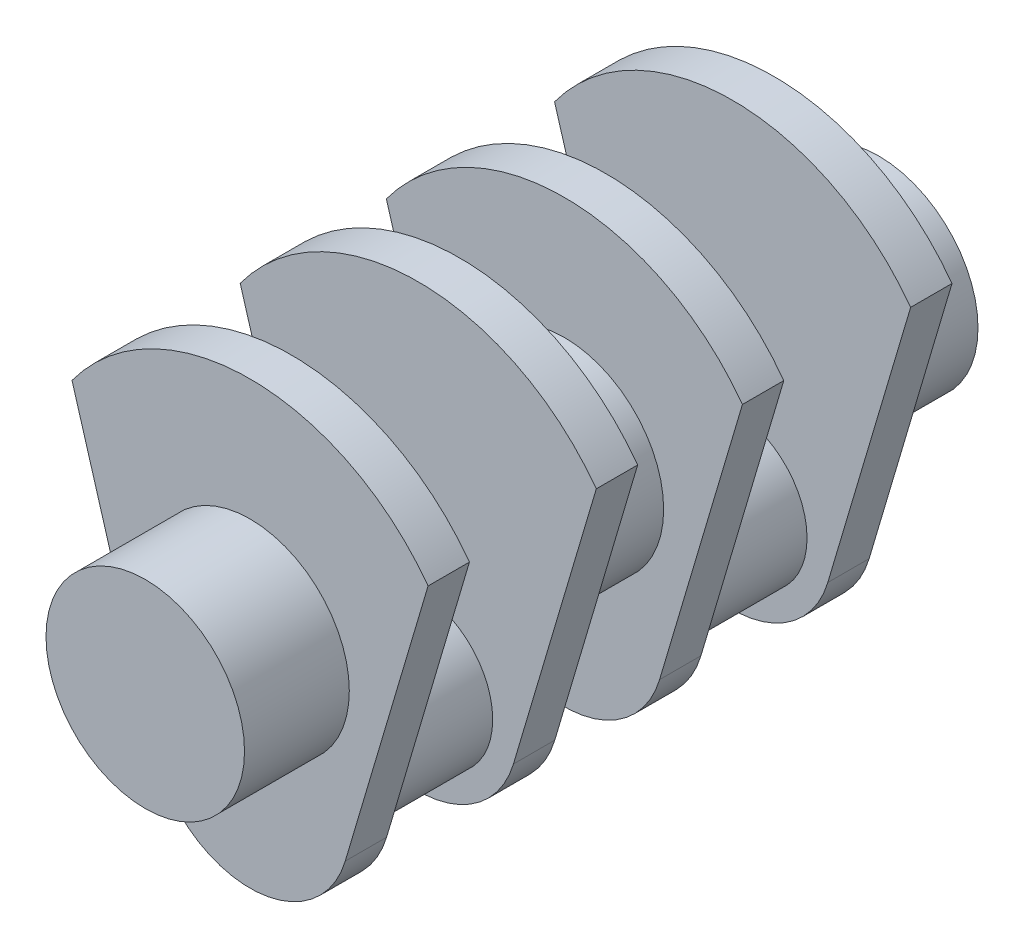
from build123d import *

# Parameters (mm, degrees)
BOSS_EXTRUDE2_DEPTH     = 15
SKETCH3_R               = 27
BOSS_EXTRUDE3_DEPTH     = 46
SKETCH4_R               = 36
BOSS_EXTRUDE4_DEPTH     = 38
MIRROR3_COPY_1_DEPTH    = 15
MIRROR3_COPY_2_SKETCH_R = 27
MIRROR3_COPY_2_DEPTH    = 46
MIRROR3_COPY_3_SKETCH_R = 36
MIRROR3_COPY_3_DEPTH    = 38
MIRROR3_COPY_4_DEPTH    = 15
MIRROR3_COPY_5_SKETCH_R = 27
MIRROR3_COPY_5_DEPTH    = 46
MIRROR3_COPY_6_SKETCH_R = 36
MIRROR3_COPY_6_DEPTH    = 38


with BuildPart() as part:
    # Sketch2 → Boss-Extrude2 (new body)
    with BuildSketch(Plane.XY):
        with BuildLine():
            Line((64.569893475, 47.23059238), (34.517510455, -54.224552409))
            ThreePointArc((34.517510455, -54.224552409), (0, -80), (-34.517510455, -54.224552409))
            Line((-34.517510455, -54.224552409), (-64.569893475, 47.23059238))
            ThreePointArc((-64.569893475, 47.23059238), (0, 80), (64.569893475, 47.23059238))
        make_face()
    boss_extrude2 = extrude(amount=BOSS_EXTRUDE2_DEPTH)

    # Sketch3 → Boss-Extrude3 (add)
    with BuildSketch(Plane.XY.offset(15)):
        with Locations((0, -44)):
            Circle(SKETCH3_R)
    boss_extrude3 = extrude(amount=BOSS_EXTRUDE3_DEPTH)

    # Sketch4 → Boss-Extrude4 (add)
    with BuildSketch(Plane(origin=(0, 0, 0), x_dir=(-1, 0, 0), z_dir=(0, 0, -1))):
        Circle(SKETCH4_R)
    boss_extrude4 = extrude(amount=BOSS_EXTRUDE4_DEPTH)

    # Mirror2: Boss-Extrude2, Boss-Extrude3, Boss-Extrude4 across plane
    add(boss_extrude2.mirror(Plane.XY.offset(38)))
    add(boss_extrude3.mirror(Plane.XY.offset(38)))
    add(boss_extrude4.mirror(Plane.XY.offset(38)))

    # Mirror3 copy 1 sketch → Mirror3 copy 1 (add)
    with BuildSketch(Plane.XY.offset(114)):
        with BuildLine():
            Line((64.569893475, 47.23059238), (34.517510455, -54.224552409))
            ThreePointArc((34.517510455, -54.224552409), (0, -80), (-34.517510455, -54.224552409))
            Line((-34.517510455, -54.224552409), (-64.569893475, 47.23059238))
            ThreePointArc((-64.569893475, 47.23059238), (0, 80), (64.569893475, 47.23059238))
        make_face()
    extrude(amount=MIRROR3_COPY_1_DEPTH)

    # Mirror3 copy 2 sketch → Mirror3 copy 2 (add)
    with BuildSketch(Plane.XY.offset(129)):
        with Locations((0, -44)):
            Circle(MIRROR3_COPY_2_SKETCH_R)
    extrude(amount=MIRROR3_COPY_2_DEPTH)

    # Mirror3 copy 3 sketch → Mirror3 copy 3 (add)
    with BuildSketch(Plane(origin=(0, 0, 114), x_dir=(-1, 0, 0), z_dir=(0, 0, -1))):
        Circle(MIRROR3_COPY_3_SKETCH_R)
    extrude(amount=MIRROR3_COPY_3_DEPTH)

    # Mirror3 copy 4 sketch → Mirror3 copy 4 (add)
    with BuildSketch(Plane(origin=(0, 0, 190), x_dir=(1, 0, 0), z_dir=(0, 0, -1))):
        with BuildLine():
            Line((64.569893475, -47.23059238), (34.517510455, 54.224552409))
            ThreePointArc((34.517510455, 54.224552409), (0, 80), (-34.517510455, 54.224552409))
            Line((-34.517510455, 54.224552409), (-64.569893475, -47.23059238))
            ThreePointArc((-64.569893475, -47.23059238), (0, -80), (64.569893475, -47.23059238))
        make_face()
    extrude(amount=MIRROR3_COPY_4_DEPTH)

    # Mirror3 copy 5 sketch → Mirror3 copy 5 (add)
    with BuildSketch(Plane(origin=(0, 0, 175), x_dir=(1, 0, 0), z_dir=(0, 0, -1))):
        with Locations((0, 44)):
            Circle(MIRROR3_COPY_5_SKETCH_R)
    extrude(amount=MIRROR3_COPY_5_DEPTH)

    # Mirror3 copy 6 sketch → Mirror3 copy 6 (add)
    with BuildSketch(Plane(origin=(0, 0, 190), x_dir=(-1, 0, 0), z_dir=(0, 0, 1))):
        Circle(MIRROR3_COPY_6_SKETCH_R)
    extrude(amount=MIRROR3_COPY_6_DEPTH)


solid = part.part
